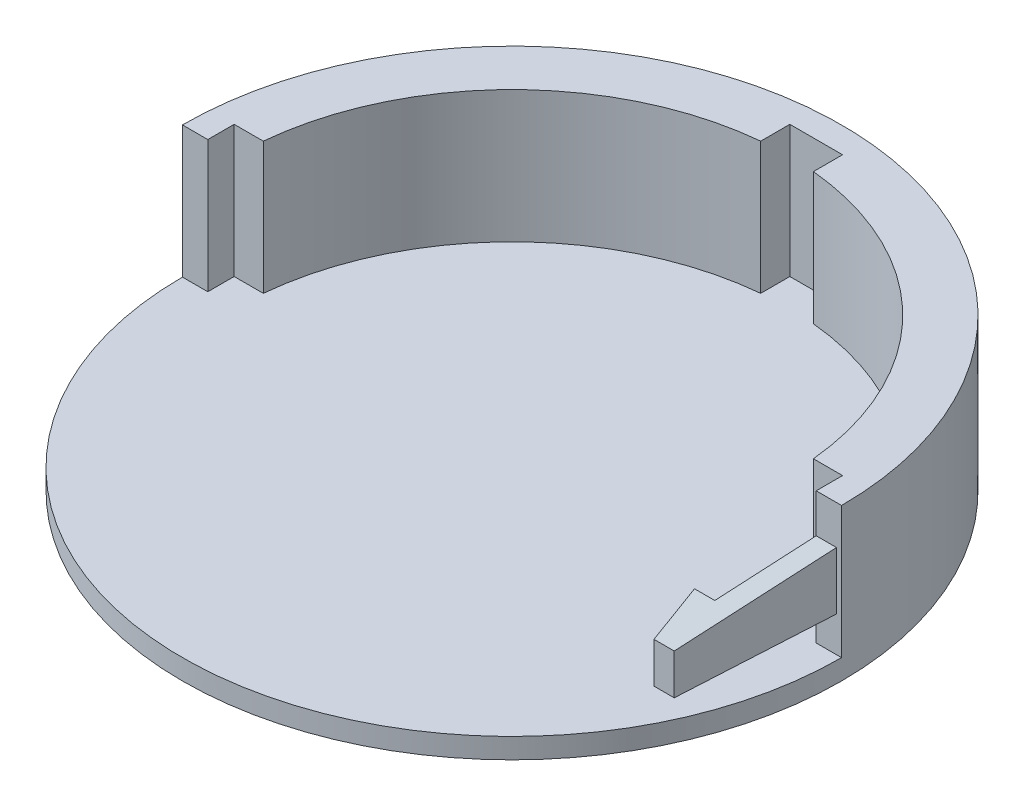
from build123d import *

# Parameters (mm, degrees)
SKETCH1_R           = 32.5
BOSS_EXTRUDE1_DEPTH = 2
SKETCH2_R           = 32.5
BOSS_EXTRUDE2_DEPTH = 13
SKETCH6_W           = 71.390071862
SKETCH6_H           = 35.774890597
CUT_EXTRUDE4_DEPTH  = 13
SNAP_START          = 30
SNAP_HOOK1_DEPTH    = 2
SNAP_START_2        = 6.002601726
SNAP_HOOK1_2_DEPTH  = 4.628893351
SNAP_START_3        = 27
SNAP_HOOK1_3_DEPTH  = 3


with BuildPart() as part:
    # Sketch1 → Boss-Extrude1 (new body)
    with BuildSketch(Plane(origin=(0, 0, 0), x_dir=(1, 0, 0), z_dir=(0, 1, 0))):
        with Locations(Location((0, 0, 0), (0, 0, 270))):
            Circle(SKETCH1_R)
    extrude(amount=BOSS_EXTRUDE1_DEPTH)

    # Sketch2 → Boss-Extrude2 (add)
    with BuildSketch(Plane(origin=(0, 2, 0), x_dir=(1, 0, 0), z_dir=(0, 1, 0))):
        with Locations(Location((0, 0, 0), (0, 0, 270))):
            Circle(SKETCH2_R)
        with BuildLine():
            Line((2.6, -27.125679715), (2.6, -30))
            Line((2.6, -30), (-2.6, -30))
            Line((-2.6, -30), (-2.6, -27.125679715))
            ThreePointArc((-2.6, -27.125679715), (-19.268659787, -19.268659787), (-27.125679715, -2.6))
            Line((-27.125679715, -2.6), (-30, -2.6))
            Line((-30, -2.6), (-30, 2.6))
            Line((-30, 2.6), (-27.125679715, 2.6))
            ThreePointArc((-27.125679715, 2.6), (-19.268659787, 19.268659787), (-2.6, 27.125679715))
            Line((-2.6, 27.125679715), (-2.6, 30))
            Line((-2.6, 30), (2.6, 30))
            Line((2.6, 30), (2.6, 27.125679715))
            ThreePointArc((2.6, 27.125679715), (19.268659787, 19.268659787), (27.125679715, 2.6))
            Line((27.125679715, 2.6), (30, 2.6))
            Line((30, 2.6), (30, -2.6))
            Line((30, -2.6), (27.125679715, -2.6))
            ThreePointArc((27.125679715, -2.6), (19.268659787, -19.268659787), (2.6, -27.125679715))
        make_face(mode=Mode.SUBTRACT)
    extrude(amount=BOSS_EXTRUDE2_DEPTH)

    # Sketch6 → Cut-Extrude4 (cut)
    with BuildSketch(Plane(origin=(0, 15, 0), x_dir=(1, 0, 0), z_dir=(0, 1, 0))):
        with Locations((0.159709333, -17.887445299)):
            Rectangle(SKETCH6_W, SKETCH6_H)
    extrude(amount=-CUT_EXTRUDE4_DEPTH, mode=Mode.SUBTRACT)

    # Snap Hook1: read off the stored shape, not the designer's step
    # Snap Hook1 outline → Snap Hook1 (add)
    with BuildSketch(Plane.YZ.offset(SNAP_START)):
        Polygon((6.317048401, 16), (5.478523933, 0), (11.15557287, 0), (10.317048401, 16), align=None)
    extrude(amount=SNAP_HOOK1_DEPTH)

    # Snap Hook1 2 outline → Snap Hook1 2 (add)
    with BuildSketch(Plane(origin=(0, 0, 0), x_dir=(1, 0, 0), z_dir=(0, 1, 0)).offset(SNAP_START_2)):
        Polygon((30, -16), (30, -10), (28, -10), align=None)
    extrude(amount=SNAP_HOOK1_2_DEPTH)

    # Snap Hook1 3 outline → Snap Hook1 3 (cut)
    with BuildSketch(Plane.YZ.offset(SNAP_START_3)):
        Polygon((6.002601726, 10), (6.317048401, 16), (6.36945618, 17), (6.002601726, 17), align=None)
        Polygon((10.631495077, 17), (10.264640622, 17), (10.317048401, 16), (10.631495077, 10), align=None)
    extrude(amount=SNAP_HOOK1_3_DEPTH, mode=Mode.SUBTRACT)


solid = part.part
